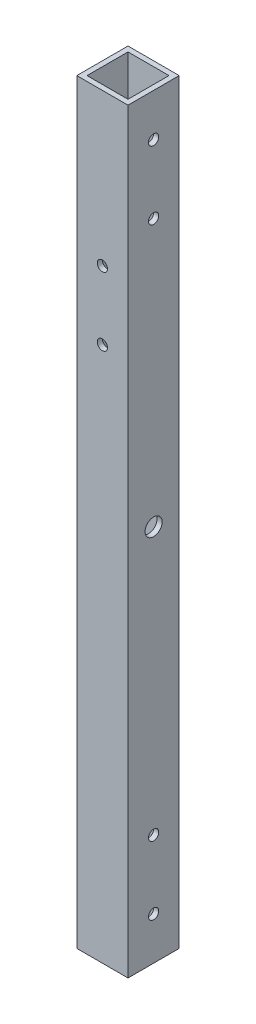
from build123d import *

# Parameters (mm, degrees)
SKETCH1_W              = 15
SKETCH1_H              = 15
SKETCH1_W_2            = 12
SKETCH1_H_2            = 12
EXTRUDE_THIN1_DEPTH    = 221.3
CUT_EXTRUDE1_OUTLINE_R = 1.5
CUT_EXTRUDE1_DEPTH     = 15
SKETCH3_R              = 2.5
CUT_EXTRUDE2_DEPTH     = 223.314394496
SKETCH4_R              = 1.5
CUT_EXTRUDE3_DEPTH     = 223.314394496


# Read off the part's stored shape, not the designer's step: Cut-Extrude1
with BuildPart() as part:
    # Sketch1 → Extrude-Thin1 (new body)
    with BuildSketch(Plane(origin=(0, 0, 0), x_dir=(1, 0, 0), z_dir=(0, 1, 0))):
        with Locations((7.5, 7.5)):
            Rectangle(SKETCH1_W, SKETCH1_H)
        with Locations((7.5, 7.5)):
            Rectangle(SKETCH1_W_2, SKETCH1_H_2, mode=Mode.SUBTRACT)
    extrude(amount=EXTRUDE_THIN1_DEPTH)

    # Cut-Extrude1 outline → Cut-Extrude1 (cut)
    with BuildSketch(Plane.YZ):
        with Locations((12.504, -7.5)):
            Circle(CUT_EXTRUDE1_OUTLINE_R)
        with Locations((32.504, -7.5)):
            Circle(CUT_EXTRUDE1_OUTLINE_R)
        with Locations((188.8, -7.5)):
            Circle(CUT_EXTRUDE1_OUTLINE_R)
        with Locations((208.8, -7.5)):
            Circle(CUT_EXTRUDE1_OUTLINE_R)
    extrude(amount=CUT_EXTRUDE1_DEPTH, mode=Mode.SUBTRACT)

    # Sketch3 → Cut-Extrude2 (cut, through all)
    with BuildSketch(Plane(origin=(15, 0, 0), x_dir=(0, 0, -1), z_dir=(1, 0, 0))):
        with Locations((7.5, 110.65)):
            Circle(SKETCH3_R)
    extrude(amount=-CUT_EXTRUDE2_DEPTH, mode=Mode.SUBTRACT)

    # Sketch4 (on Front Plane) → Cut-Extrude3 (cut, through all)
    with BuildSketch(Plane.XY):
        with Locations((7.5, 156.8)):
            Circle(SKETCH4_R)
        with Locations((7.5, 176.8)):
            Circle(SKETCH4_R)
    extrude(amount=-CUT_EXTRUDE3_DEPTH, mode=Mode.SUBTRACT)


solid = part.part
